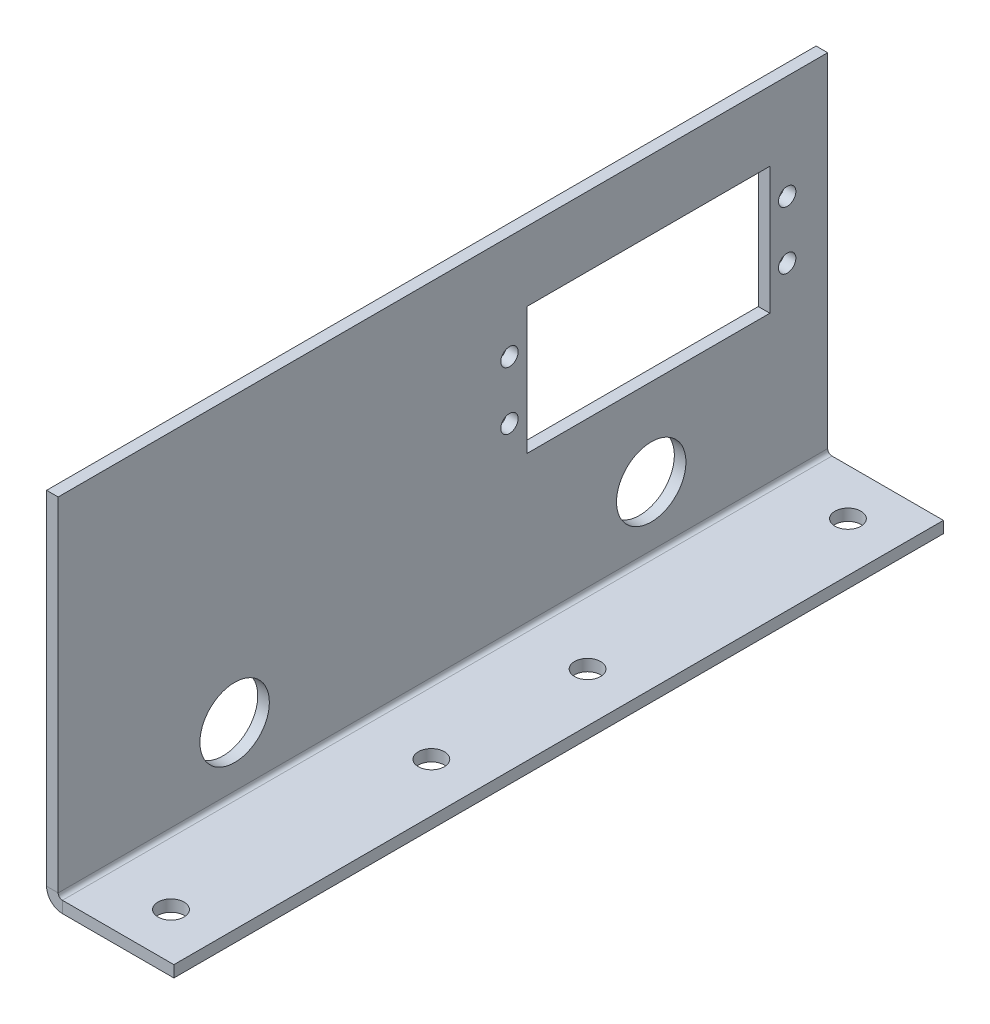
from build123d import *

# Parameters (mm, degrees)
SM_BASE_FLANGE_1_DEPTH = 133
CUT_EXTRUDE_1_REACH    = 149.557
SKETCH_2_R             = 6
SKETCH_2_W             = 42
SKETCH_2_H             = 22
M4X0_7_3_D             = 2.5
M4X0_7_3_DEPTH         = 7.5
M4X0_7_3_CBORE_D       = 3
M4X0_7_3_CBORE_DEPTH   = 6
M4X0_7_3_TIP           = 0.751075774
SKETCH_6_R             = 2.25
CUT_EXTRUDE_2_DEPTH    = 148.271857461


# Sheet-metal steps are written as plain solids
with BuildPart() as part:
    # Sketch 1 → 基材-凸緣1 (new body)
    with BuildSketch(Plane.XY):
        with BuildLine():
            Line((0, 60), (0, 0.7366))
            ThreePointArc((0, 0.7366), (0.215745145, 0.215745145), (0.7366, 0))
            Line((0.7366, 0), (20, 0))
            Line((20, 0), (20, -2))
            Line((20, -2), (0.7366, -2))
            ThreePointArc((0.7366, -2), (-1.198468417, -1.198468417), (-2, 0.7366))
            Line((-2, 0.7366), (-2, 60))
            Line((-2, 60), (0, 60))
        make_face()
    extrude(amount=SM_BASE_FLANGE_1_DEPTH)

    # Sketch 2 → 除料-伸長1 (cut, up to next)
    with BuildSketch(Plane.ZY.offset(2), mode=Mode.PRIVATE) as cut_extrude_1_sk1:
        with Locations((102.5, 11)):
            Circle(SKETCH_2_R)
    cut_extrude_1_tool1 = extrude(cut_extrude_1_sk1.sketch, amount=-CUT_EXTRUDE_1_REACH, mode=Mode.PRIVATE) & part.part
    # Sketch 2 → 除料-伸長1 (cut, up to next)
    with BuildSketch(Plane.ZY.offset(2), mode=Mode.PRIVATE) as cut_extrude_1_sk2:
        with Locations(Location((30.5, 11, 0), (0, 0, 180))):
            Circle(SKETCH_2_R)
    cut_extrude_1_tool2 = extrude(cut_extrude_1_sk2.sketch, amount=-CUT_EXTRUDE_1_REACH, mode=Mode.PRIVATE) & part.part
    # Sketch 2 → 除料-伸長1 (cut, up to next)
    with BuildSketch(Plane.ZY.offset(2), mode=Mode.PRIVATE) as cut_extrude_1_sk3:
        with Locations((31, 37)):
            Rectangle(SKETCH_2_W, SKETCH_2_H)
    cut_extrude_1_tool3 = extrude(cut_extrude_1_sk3.sketch, amount=-CUT_EXTRUDE_1_REACH, mode=Mode.PRIVATE) & part.part
    add(cut_extrude_1_tool1.solids().sort_by_distance((-2, 11, 102.5))[0], mode=Mode.SUBTRACT)
    add(cut_extrude_1_tool2.solids().sort_by_distance((-2, 11, 30.5))[0], mode=Mode.SUBTRACT)
    add(cut_extrude_1_tool3.solids().sort_by_distance((-2, 37, 31))[0], mode=Mode.SUBTRACT)

    # M4x0.7 螺紋孔3
    with Locations(Plane.ZY.offset(2)):
        with Locations((55, 42), (55, 32), (7, 42), (7, 32)):
            CounterBoreHole(M4X0_7_3_D / 2, M4X0_7_3_CBORE_D / 2, M4X0_7_3_CBORE_DEPTH, depth=M4X0_7_3_DEPTH)
            with Locations((0, 0, -(M4X0_7_3_DEPTH + M4X0_7_3_TIP / 2))):  # 118° drill point
                Cone(0, M4X0_7_3_D / 2, M4X0_7_3_TIP, mode=Mode.SUBTRACT)

    # 草圖6 → 除料-伸長2 (cut, through all)
    with BuildSketch(Plane(origin=(0, 0, 0), x_dir=(1, 0, 0), z_dir=(0, 1, 0))):
        with Locations(Location((11.5, -125, 0), (0, 0, 270))):
            Circle(SKETCH_6_R)
        with Locations(Location((11.5, -80, 0), (0, 0, 270))):
            Circle(SKETCH_6_R)
        with Locations(Location((11.5, -8, 0), (0, 0, 270))):
            Circle(SKETCH_6_R)
        with Locations(Location((11.5, -53, 0), (0, 0, 270))):
            Circle(SKETCH_6_R)
    extrude(amount=-CUT_EXTRUDE_2_DEPTH, mode=Mode.SUBTRACT)


solid = part.part
